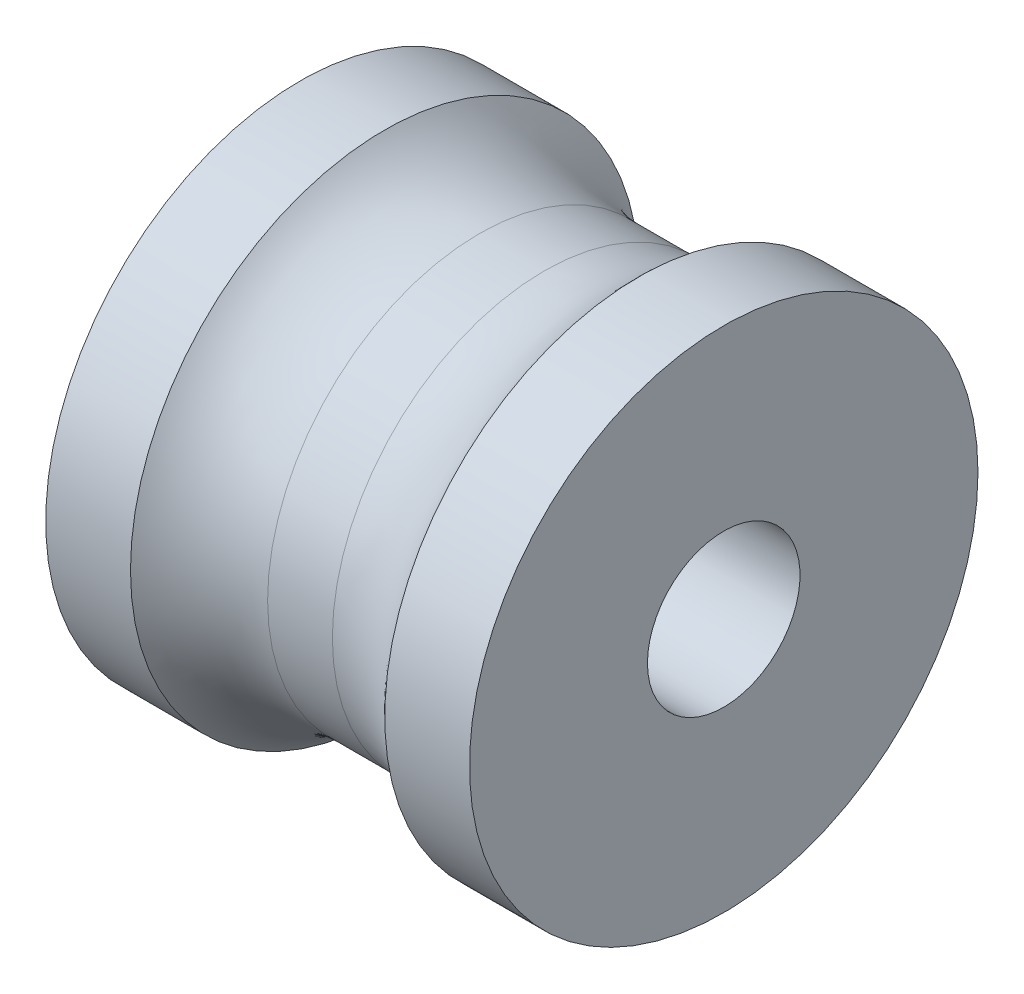
from build123d import *

# Parameters (mm, degrees)
SKETCH1_R           = 6
BOSS_EXTRUDE1_DEPTH = 2
SKETCH2_R           = 5
BOSS_EXTRUDE2_DEPTH = 6
SKETCH3_R           = 6
BOSS_EXTRUDE3_DEPTH = 2
FILLET1_R           = 3
SKETCH4_R           = 1.8
CUT_EXTRUDE1_DEPTH  = 14.114877049


with BuildPart() as part:
    # Sketch1 → Boss-Extrude1 (new body)
    with BuildSketch(Plane(origin=(0, 0, 0), x_dir=(0, 0, -1), z_dir=(1, 0, 0))):
        Circle(SKETCH1_R)
    extrude(amount=BOSS_EXTRUDE1_DEPTH)

    # Sketch2 → Boss-Extrude2 (add)
    with BuildSketch(Plane(origin=(2, 0, 0), x_dir=(0, 0, -1), z_dir=(1, 0, 0))):
        Circle(SKETCH2_R)
    extrude(amount=BOSS_EXTRUDE2_DEPTH)

    # Sketch3 → Boss-Extrude3 (add)
    with BuildSketch(Plane(origin=(8, 0, 0), x_dir=(0, 0, -1), z_dir=(1, 0, 0))):
        Circle(SKETCH3_R)
    extrude(amount=BOSS_EXTRUDE3_DEPTH)

    # Fillet1
    # the kernel refuses this fillet: 3 mm, written as the material it adds along each edge
    with BuildSketch(Plane(origin=(2, 0, 0), x_dir=(0, 0, -1), z_dir=(0, -1, 0))) as fillet1_piece_1:
        with BuildLine():
            CenterArc((8, 2.236067977), FILLET1_R, 180, 48.189685104)
            Line((6, 0), (5.96, -0.04472136))
            ThreePointArc((5.96, -0.04472136), (5.5, -0.06), (5, -0.06))
            Line((5, -0.06), (4.94, 0))
            Line((4.94, 0), (4.94, 2.236067977))
            Line((4.94, 2.236067977), (5, 2.236067977))
        make_face()
    revolve(axis=Axis((2, 0, 0), (1, 0, 0)))
    with BuildSketch(Plane(origin=(8, 0, 0), x_dir=(0, 0, -1), z_dir=(0, -1, 0))) as fillet1_piece_2:
        with BuildLine():
            CenterArc((8, -2.236067977), FILLET1_R, 131.810314896, 48.189685104)
            Line((5, -2.236067977), (4.94, -2.236067977))
            Line((4.94, -2.236067977), (4.94, 0))
            Line((4.94, 0), (5, 0.06))
            ThreePointArc((5, 0.06), (5.5, 0.06), (5.96, 0.04472136))
            Line((5.96, 0.04472136), (6, 0))
        make_face()
    revolve(axis=Axis((8, 0, 0), (1, 0, 0)))

    # Sketch4 → Cut-Extrude1 (cut, through all)
    with BuildSketch(Plane.ZY):
        Circle(SKETCH4_R)
    extrude(amount=-CUT_EXTRUDE1_DEPTH, mode=Mode.SUBTRACT)


solid = part.part
